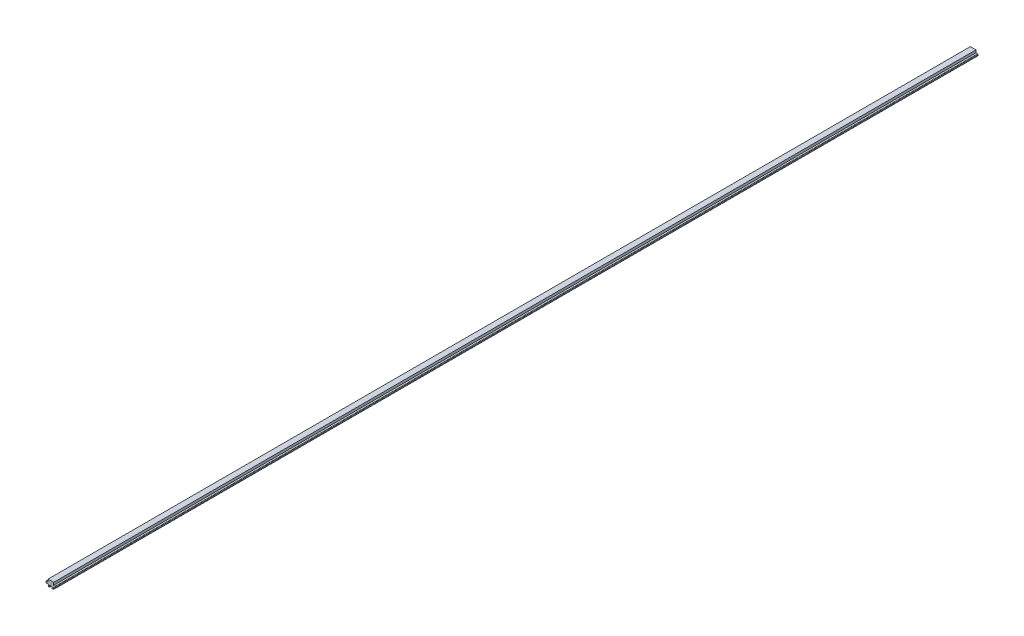
from build123d import *

# Parameters (mm, degrees)
BOSS_EXTRUDE1_DEPTH = 1000
FILLET1_R           = 0.5
FILLET2_R           = 0.5


with BuildPart() as part:
    # Sketch2 → Boss-Extrude1 (new body)
    with BuildSketch(Plane.XY):
        Polygon((1.633353761, 2.876842427), (-4.466646239, 2.876842427), (-4.466646239, 0.126842427), (-6.666646239, 0.126842427), (-6.666646239, -1.873157573), (-4.216646239, -1.873157573), (-4.216646239, -4.073157573), (-2.716646239, -4.073157573), (-2.716646239, -1.873157573), (-0.116646239, -1.873157573), (-0.116646239, -4.073157573), (1.383353761, -4.073157573), (1.383353761, -1.873157573), (3.833353761, -1.873157573), (3.833353761, 0.126842427), (1.633353761, 0.126842427), align=None)
    extrude(amount=BOSS_EXTRUDE1_DEPTH)

    # Fillet1
    fillet1_edges = [part.edges().sort_by_distance(p)[0] for p in [
        (3.833353761, -1.873157573, 500),
        (3.833353761, 0.126842427, 500),
        (-6.666646239, -1.873157573, 500),
        (-6.666646239, 0.126842427, 500),
    ]]
    fillet(fillet1_edges, radius=FILLET1_R)

    # Fillet2
    fillet2_edges = [part.edges().sort_by_distance(p)[0] for p in [
        (1.383353761, -4.073157573, 500),
        (-0.116646239, -4.073157573, 500),
        (-4.216646239, -4.073157573, 500),
        (-2.716646239, -4.073157573, 500),
    ]]
    fillet(fillet2_edges, radius=FILLET2_R)


solid = part.part
